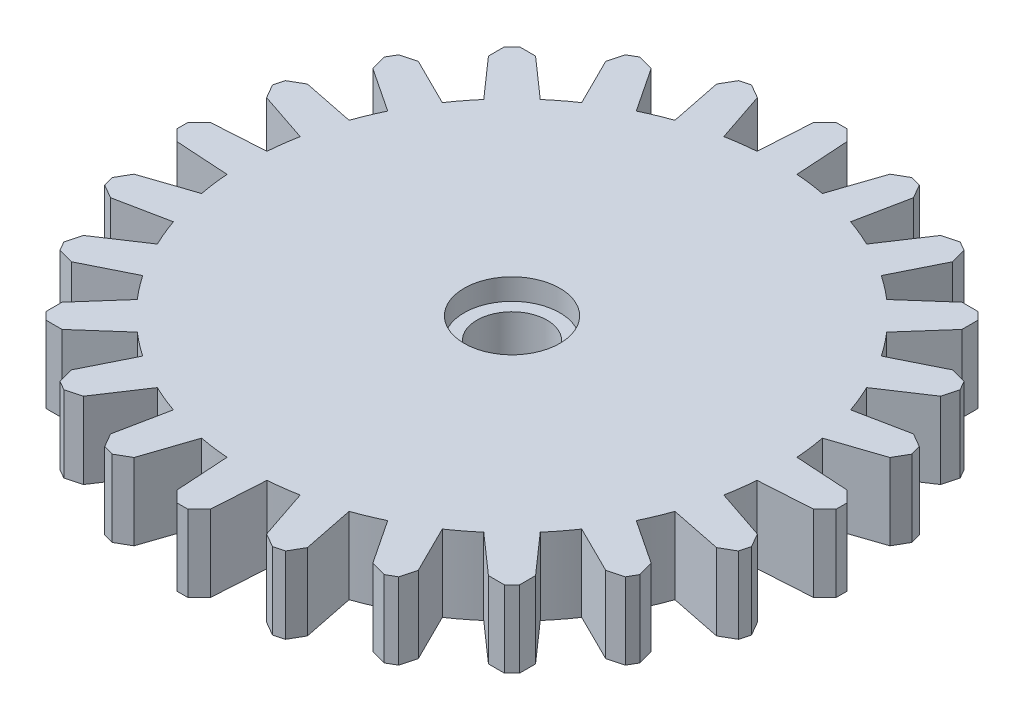
from build123d import *

# Parameters (mm, degrees)
SKETCH1_R             = 12.5
BOSS_EXTRUDE1_DEPTH   = 3.6
CUT_EXTRUDE1_REACH    = 20.041
SKETCH3_R             = 1.65
SKETCH4_R             = 2.25
CUT_EXTRUDE2_DEPTH    = 1
BOSS_EXTRUDE2_DEPTH   = 3.6
CHAMFER1_SIZE         = 0.5
CHAMFER1_SIZE2        = 0.534373985
CHAMFER1_EDGE_2_SIZE  = 0.5
CHAMFER1_EDGE_2_SIZE2 = 0.534373985
CIRPATTERN2_DEPTH     = 3.6


# Read off the part's stored shape, not the designer's step: CirPattern2
with BuildPart() as part:
    # Sketch1 → Boss-Extrude1 (new body)
    with BuildSketch(Plane(origin=(0, 0, 0), x_dir=(1, 0, 0), z_dir=(0, 1, 0))):
        with Locations(Location((0, 0, 0), (0, 0, 270))):
            Circle(SKETCH1_R)
    extrude(amount=BOSS_EXTRUDE1_DEPTH)

    # Sketch3 → Cut-Extrude1 (cut, up to next)
    with BuildSketch(Plane(origin=(0, 3.6, 0), x_dir=(1, 0, 0), z_dir=(0, 1, 0)), mode=Mode.PRIVATE) as cut_extrude1_sk1:
        with Locations(Location((0, 0, 0), (0, 0, 270))):
            Circle(SKETCH3_R)
    cut_extrude1_tool1 = extrude(cut_extrude1_sk1.sketch, amount=-CUT_EXTRUDE1_REACH, mode=Mode.PRIVATE) & part.part
    add(cut_extrude1_tool1.solids().sort_by_distance((0, 3.6, 0))[0], mode=Mode.SUBTRACT)

    # Sketch4 → Cut-Extrude2 (cut)
    with BuildSketch(Plane(origin=(0, 3.6, 0), x_dir=(1, 0, 0), z_dir=(0, 1, 0))):
        with Locations(Location((0, 0, 0), (0, 0, 270))):
            Circle(SKETCH4_R)
    extrude(amount=-CUT_EXTRUDE2_DEPTH, mode=Mode.SUBTRACT)

    # Sketch2 → Boss-Extrude2 (add)
    with BuildSketch(Plane(origin=(0, 3.6, 0), x_dir=(1, 0, 0), z_dir=(0, 1, 0))):
        Polygon((1, 11.5), (-1, 11.5), (-0.75, 15.5), (0.75, 15.5), align=None)
    extrude(amount=-BOSS_EXTRUDE2_DEPTH)

    # Chamfer1
    chamfer1_edges = [part.edges().sort_by_distance(p)[0] for p in [
        (0.75, 1.8, -15.5),
    ]]
    chamfer1_side = [part.faces().sort_by_distance(p)[0] for p in [
        (0, 1.8, -15.5),
    ]]
    chamfer(chamfer1_edges, length=CHAMFER1_SIZE, length2=CHAMFER1_SIZE2, reference=chamfer1_side[0])

    # Chamfer1 edge 2
    chamfer1_edge_2_edges = [part.edges().sort_by_distance(p)[0] for p in [
        (-0.75, 1.8, -15.5),
    ]]
    chamfer1_edge_2_side = [part.faces().sort_by_distance(p)[0] for p in [
        (0, 1.8, -15.5),
    ]]
    chamfer(chamfer1_edge_2_edges, length=CHAMFER1_EDGE_2_SIZE, length2=CHAMFER1_EDGE_2_SIZE2, reference=chamfer1_edge_2_side[0])

    # CirPattern2 outline → CirPattern2 (add)
    with BuildSketch(Plane(origin=(0, 0, 0), x_dir=(1, 0, 0), z_dir=(0, 1, 0))):
        with BuildLine():
            Line((-4.630300272, 14.253948281), (-4.133773939, 11.796690766))
            ThreePointArc((-4.133773939, 11.796690766), (-3.235238064, 12.074072829), (-2.318392138, 12.283120853))
            Line((-2.318392138, 12.283120853), (-3.117016478, 14.659431452))
            Line((-3.117016478, 14.659431452), (-3.770213743, 15.036555069))
            Line((-3.770213743, 15.036555069), (-4.253176656, 14.907145546))
            Line((-4.253176656, 14.907145546), (-4.630300272, 14.253948281))
        make_face()
        with BuildLine():
            Line((-8.1617199, 12.569846877), (-7.046127247, 10.324828852))
            ThreePointArc((-7.046127247, 10.324828852), (-6.25, 10.825317548), (-5.418500451, 11.264539621))
            Line((-5.418500451, 11.264539621), (-6.804946767, 13.35318021))
            Line((-6.804946767, 13.35318021), (-7.533493649, 13.548393759))
            Line((-7.533493649, 13.548393759), (-7.966506351, 13.298393759))
            Line((-7.966506351, 13.298393759), (-8.1617199, 12.569846877))
        make_face()
        with BuildLine():
            Line((-11.136931804, 10.02913118), (-9.478298628, 8.149346914))
            ThreePointArc((-9.478298628, 8.149346914), (-8.838834765, 8.838834765), (-8.149346914, 9.478298628))
            Line((-8.149346914, 9.478298628), (-10.02913118, 11.136931804))
            Line((-10.02913118, 11.136931804), (-10.783378413, 11.136931804))
            Line((-10.783378413, 11.136931804), (-11.136931804, 10.783378413))
            Line((-11.136931804, 10.783378413), (-11.136931804, 10.02913118))
        make_face()
        with BuildLine():
            Line((-13.35318021, 6.804946767), (-11.264539621, 5.418500451))
            ThreePointArc((-11.264539621, 5.418500451), (-10.825317548, 6.25), (-10.324828852, 7.046127247))
            Line((-10.324828852, 7.046127247), (-12.569846877, 8.1617199))
            Line((-12.569846877, 8.1617199), (-13.298393759, 7.966506351))
            Line((-13.298393759, 7.966506351), (-13.548393759, 7.533493649))
            Line((-13.548393759, 7.533493649), (-13.35318021, 6.804946767))
        make_face()
        with BuildLine():
            Line((-14.659431452, 3.117016478), (-12.283120853, 2.318392138))
            ThreePointArc((-12.283120853, 2.318392138), (-12.074072829, 3.235238064), (-11.796690766, 4.133773939))
            Line((-11.796690766, 4.133773939), (-14.253948281, 4.630300272))
            Line((-14.253948281, 4.630300272), (-14.907145546, 4.253176656))
            Line((-14.907145546, 4.253176656), (-15.036555069, 3.770213743))
            Line((-15.036555069, 3.770213743), (-14.659431452, 3.117016478))
        make_face()
        with BuildLine():
            ThreePointArc((2.318392138, 12.283120853), (3.235238064, 12.074072829), (4.133773939, 11.796690766))
            Line((4.133773939, 11.796690766), (4.630300272, 14.253948281))
            Line((4.630300272, 14.253948281), (4.253176656, 14.907145546))
            Line((4.253176656, 14.907145546), (3.770213743, 15.036555069))
            Line((3.770213743, 15.036555069), (3.117016478, 14.659431452))
            Line((3.117016478, 14.659431452), (2.318392138, 12.283120853))
        make_face()
        with BuildLine():
            ThreePointArc((5.418500451, 11.264539621), (6.25, 10.825317548), (7.046127247, 10.324828852))
            Line((7.046127247, 10.324828852), (8.1617199, 12.569846877))
            Line((8.1617199, 12.569846877), (7.966506351, 13.298393759))
            Line((7.966506351, 13.298393759), (7.533493649, 13.548393759))
            Line((7.533493649, 13.548393759), (6.804946767, 13.35318021))
            Line((6.804946767, 13.35318021), (5.418500451, 11.264539621))
        make_face()
        with BuildLine():
            ThreePointArc((8.149346914, 9.478298628), (8.838834765, 8.838834765), (9.478298628, 8.149346914))
            Line((9.478298628, 8.149346914), (11.136931804, 10.02913118))
            Line((11.136931804, 10.02913118), (11.136931804, 10.783378413))
            Line((11.136931804, 10.783378413), (10.783378413, 11.136931804))
            Line((10.783378413, 11.136931804), (10.02913118, 11.136931804))
            Line((10.02913118, 11.136931804), (8.149346914, 9.478298628))
        make_face()
        with BuildLine():
            ThreePointArc((10.324828852, 7.046127247), (10.825317548, 6.25), (11.264539621, 5.418500451))
            Line((11.264539621, 5.418500451), (13.35318021, 6.804946767))
            Line((13.35318021, 6.804946767), (13.548393759, 7.533493649))
            Line((13.548393759, 7.533493649), (13.298393759, 7.966506351))
            Line((13.298393759, 7.966506351), (12.569846877, 8.1617199))
            Line((12.569846877, 8.1617199), (10.324828852, 7.046127247))
        make_face()
        with BuildLine():
            ThreePointArc((11.796690766, 4.133773939), (12.074072829, 3.235238064), (12.283120853, 2.318392138))
            Line((12.283120853, 2.318392138), (14.659431452, 3.117016478))
            Line((14.659431452, 3.117016478), (15.036555069, 3.770213743))
            Line((15.036555069, 3.770213743), (14.907145546, 4.253176656))
            Line((14.907145546, 4.253176656), (14.253948281, 4.630300272))
            Line((14.253948281, 4.630300272), (11.796690766, 4.133773939))
        make_face()
        with BuildLine():
            ThreePointArc((12.464627699, 0.939710769), (12.5, 0), (12.464627699, -0.939710769))
            Line((12.464627699, -0.939710769), (14.966666667, -0.783333333))
            Line((14.966666667, -0.783333333), (15.5, -0.25))
            Line((15.5, -0.25), (15.5, 0.25))
            Line((15.5, 0.25), (14.966666667, 0.783333333))
            Line((14.966666667, 0.783333333), (12.464627699, 0.939710769))
        make_face()
        with BuildLine():
            ThreePointArc((12.283120853, -2.318392138), (12.074072829, -3.235238064), (11.796690766, -4.133773939))
            Line((11.796690766, -4.133773939), (14.253948281, -4.630300272))
            Line((14.253948281, -4.630300272), (14.907145546, -4.253176656))
            Line((14.907145546, -4.253176656), (15.036555069, -3.770213743))
            Line((15.036555069, -3.770213743), (14.659431452, -3.117016478))
            Line((14.659431452, -3.117016478), (12.283120853, -2.318392138))
        make_face()
        with BuildLine():
            ThreePointArc((11.26453962, -5.418500451), (10.825317548, -6.25), (10.324828852, -7.046127247))
            Line((10.324828852, -7.046127247), (12.569846877, -8.1617199))
            Line((12.569846877, -8.1617199), (13.298393759, -7.966506351))
            Line((13.298393759, -7.966506351), (13.548393759, -7.533493649))
            Line((13.548393759, -7.533493649), (13.35318021, -6.804946767))
            Line((13.35318021, -6.804946767), (11.26453962, -5.418500451))
        make_face()
        with BuildLine():
            ThreePointArc((9.478298628, -8.149346914), (8.838834765, -8.838834765), (8.149346914, -9.478298628))
            Line((8.149346914, -9.478298628), (10.02913118, -11.136931804))
            Line((10.02913118, -11.136931804), (10.783378413, -11.136931804))
            Line((10.783378413, -11.136931804), (11.136931804, -10.783378413))
            Line((11.136931804, -10.783378413), (11.136931804, -10.02913118))
            Line((11.136931804, -10.02913118), (9.478298628, -8.149346914))
        make_face()
        with BuildLine():
            ThreePointArc((7.046127247, -10.324828852), (6.25, -10.825317548), (5.418500451, -11.26453962))
            Line((5.418500451, -11.26453962), (6.804946767, -13.35318021))
            Line((6.804946767, -13.35318021), (7.533493649, -13.548393759))
            Line((7.533493649, -13.548393759), (7.966506351, -13.298393759))
            Line((7.966506351, -13.298393759), (8.1617199, -12.569846877))
            Line((8.1617199, -12.569846877), (7.046127247, -10.324828852))
        make_face()
        with BuildLine():
            ThreePointArc((4.133773939, -11.796690766), (3.235238064, -12.074072829), (2.318392138, -12.283120853))
            Line((2.318392138, -12.283120853), (3.117016478, -14.659431452))
            Line((3.117016478, -14.659431452), (3.770213743, -15.036555069))
            Line((3.770213743, -15.036555069), (4.253176656, -14.907145546))
            Line((4.253176656, -14.907145546), (4.630300272, -14.253948281))
            Line((4.630300272, -14.253948281), (4.133773939, -11.796690766))
        make_face()
        with BuildLine():
            ThreePointArc((0.939710769, -12.464627699), (0, -12.5), (-0.939710769, -12.464627699))
            Line((-0.939710769, -12.464627699), (-0.783333333, -14.966666667))
            Line((-0.783333333, -14.966666667), (-0.25, -15.5))
            Line((-0.25, -15.5), (0.25, -15.5))
            Line((0.25, -15.5), (0.783333333, -14.966666667))
            Line((0.783333333, -14.966666667), (0.939710769, -12.464627699))
        make_face()
        with BuildLine():
            ThreePointArc((-2.318392138, -12.283120853), (-3.235238064, -12.074072829), (-4.133773939, -11.796690766))
            Line((-4.133773939, -11.796690766), (-4.630300272, -14.253948281))
            Line((-4.630300272, -14.253948281), (-4.253176656, -14.907145546))
            Line((-4.253176656, -14.907145546), (-3.770213743, -15.036555069))
            Line((-3.770213743, -15.036555069), (-3.117016478, -14.659431452))
            Line((-3.117016478, -14.659431452), (-2.318392138, -12.283120853))
        make_face()
        with BuildLine():
            ThreePointArc((-5.418500451, -11.26453962), (-6.25, -10.825317548), (-7.046127247, -10.324828852))
            Line((-7.046127247, -10.324828852), (-8.1617199, -12.569846877))
            Line((-8.1617199, -12.569846877), (-7.966506351, -13.298393759))
            Line((-7.966506351, -13.298393759), (-7.533493649, -13.548393759))
            Line((-7.533493649, -13.548393759), (-6.804946767, -13.35318021))
            Line((-6.804946767, -13.35318021), (-5.418500451, -11.26453962))
        make_face()
        with BuildLine():
            ThreePointArc((-8.149346914, -9.478298628), (-8.838834765, -8.838834765), (-9.478298628, -8.149346914))
            Line((-9.478298628, -8.149346914), (-11.136931804, -10.02913118))
            Line((-11.136931804, -10.02913118), (-11.136931804, -10.783378413))
            Line((-11.136931804, -10.783378413), (-10.783378413, -11.136931804))
            Line((-10.783378413, -11.136931804), (-10.02913118, -11.136931804))
            Line((-10.02913118, -11.136931804), (-8.149346914, -9.478298628))
        make_face()
        with BuildLine():
            ThreePointArc((-10.324828852, -7.046127247), (-10.825317548, -6.25), (-11.26453962, -5.418500451))
            Line((-11.26453962, -5.418500451), (-13.35318021, -6.804946767))
            Line((-13.35318021, -6.804946767), (-13.548393759, -7.533493649))
            Line((-13.548393759, -7.533493649), (-13.298393759, -7.966506351))
            Line((-13.298393759, -7.966506351), (-12.569846877, -8.1617199))
            Line((-12.569846877, -8.1617199), (-10.324828852, -7.046127247))
        make_face()
        with BuildLine():
            ThreePointArc((-11.796690766, -4.133773939), (-12.074072829, -3.235238064), (-12.283120853, -2.318392138))
            Line((-12.283120853, -2.318392138), (-14.659431452, -3.117016478))
            Line((-14.659431452, -3.117016478), (-15.036555069, -3.770213743))
            Line((-15.036555069, -3.770213743), (-14.907145546, -4.253176656))
            Line((-14.907145546, -4.253176656), (-14.253948281, -4.630300272))
            Line((-14.253948281, -4.630300272), (-11.796690766, -4.133773939))
        make_face()
        with BuildLine():
            Line((-14.966666667, 0.783333333), (-15.5, 0.25))
            Line((-15.5, 0.25), (-15.5, -0.25))
            Line((-15.5, -0.25), (-14.966666667, -0.783333333))
            Line((-14.966666667, -0.783333333), (-12.464627699, -0.939710769))
            ThreePointArc((-12.464627699, -0.939710769), (-12.5, 0), (-12.464627699, 0.939710769))
            Line((-12.464627699, 0.939710769), (-14.966666667, 0.783333333))
        make_face()
    extrude(amount=CIRPATTERN2_DEPTH)


solid = part.part
